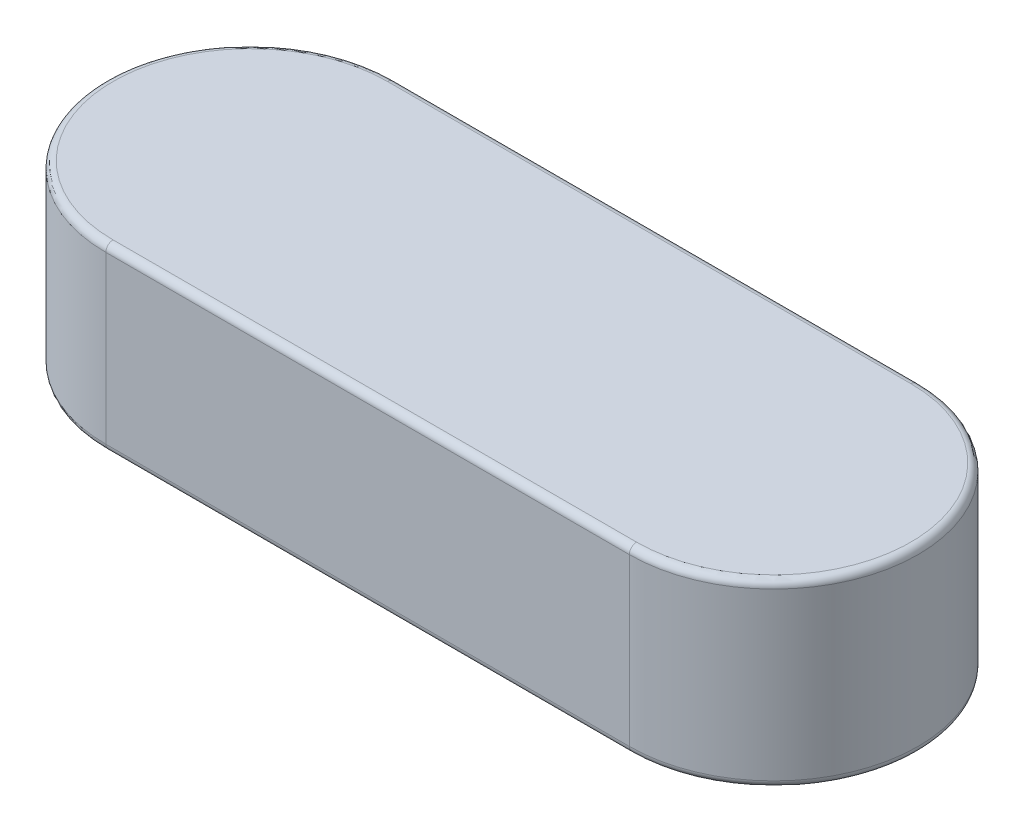
from build123d import *

# Parameters (mm, degrees)
EXTRUDE1_DEPTH = 10
FILLET1_R      = 0.4


with BuildPart() as part:
    # Sketch1 → Extrude1 (new body)
    with BuildSketch(Plane(origin=(0, 0, 0), x_dir=(1, 0, 0), z_dir=(0, 1, 0))):
        with BuildLine():
            Line((-29, 8), (0, 8))
            ThreePointArc((0, 8), (8, 0), (0, -8))
            Line((0, -8), (-29, -8))
            ThreePointArc((-29, -8), (-37, 0), (-29, 8))
        make_face()
    extrude(amount=EXTRUDE1_DEPTH)

    # Fillet1
    fillet1_edges = [part.edges().sort_by_distance(p)[0] for p in [
        (-14.5, 0, -8),
        (8, 0, 0),
        (-37, 0, 0),
        (-14.5, 0, 8),
        (8, 10, 0),
        (-14.5, 10, 8),
        (-14.5, 10, -8),
        (-37, 10, 0),
    ]]
    fillet(fillet1_edges, radius=FILLET1_R)


solid = part.part
